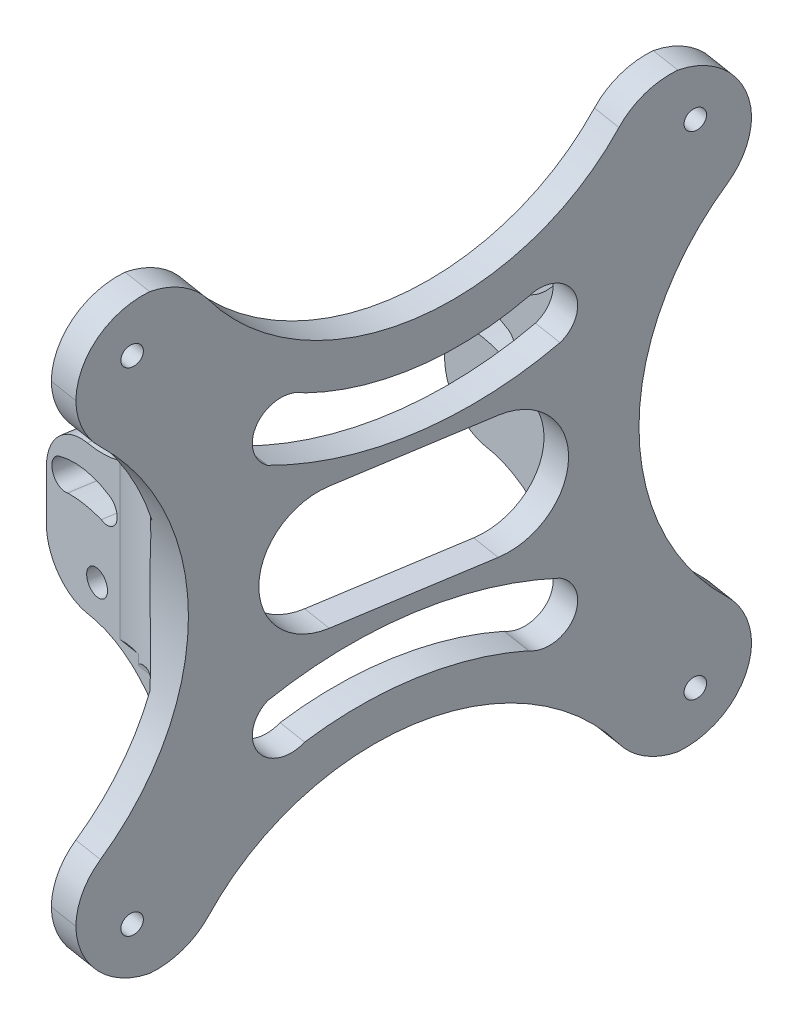
from build123d import *

# Parameters (mm, degrees)
ESQUISSE2_W                  = 31
ESQUISSE2_H                  = 30
ESQUISSE2_R                  = 2.55
BOSS_EXTRU_1_DEPTH           = 6
ESQUISSE8_W                  = 31
ESQUISSE8_H                  = 30
ESQUISSE8_R                  = 2.55
BOSS_EXTRU_3_DEPTH           = 6
ESQUISSE7_W                  = 120
ESQUISSE7_H                  = 120
ESQUISSE7_R                  = 2
BOSS_EXTRU_5_DEPTH           = 6
ESQUISSE13_W                 = 21.641206158
ESQUISSE13_H                 = 30
ESQUISSE13_W_2               = 21.658793842
BOSS_EXTRU_6_DEPTH           = 13
ENL_V_MAT_EXTRU_1_DEPTH      = 13
ENL_V_MAT_EXTRU_1_DEPTH_BACK = 10
ENL_V_MAT_EXTRU_2_DEPTH      = 10
CONG_1_R                     = 14
CONG_2_R                     = 10
ESQUISSE16_W                 = 6
ESQUISSE16_H                 = 20
BOSS_EXTRU_7_DEPTH           = 21
ENL_V_MAT_EXTRU_5_DEPTH      = 102
ESQUISSE11_R                 = 3.6
ENL_V_MAT_EXTRU_3_DEPTH      = 2
ENL_V_MAT_EXTRU_4_DEPTH      = 50
CONG_3_R                     = 2
ENL_V_MAT_EXTRU_6_DEPTH      = 10


with BuildPart() as part:
    # Esquisse2 → Boss.-Extru.1 (new body)
    with BuildSketch(Plane(origin=(0.906224424, 0, -5.721675829), x_dir=(0.9876883405951378, 0, 0.15643446504023084), z_dir=(-0.15643446504023084, 0, 0.9876883405951378))):
        with Locations((34.5, -1.155063291)):
            Rectangle(ESQUISSE2_W, ESQUISSE2_H)
        with Locations(Location((31.397260685, -9.369554149, 0), (0, 0, 180))):
            Circle(ESQUISSE2_R, mode=Mode.SUBTRACT)
        with BuildLine():
            ThreePointArc((34.496035861, 7.577601288), (36.106578838, 3.890320367), (32.419297917, 2.27977739))
            ThreePointArc((32.419297917, 2.27977739), (28.322675088, 2.630124236), (24.226052259, 2.27977739))
            ThreePointArc((24.226052259, 2.27977739), (20.538771338, 3.890320367), (22.149314314, 7.577601288))
            ThreePointArc((22.149314314, 7.577601288), (28.322675088, 8.74435419), (34.496035861, 7.577601288))
        make_face(mode=Mode.SUBTRACT)
    extrude(amount=BOSS_EXTRU_1_DEPTH)



with BuildPart() as body_2:
    # Esquisse8 → Boss.-Extru.3 (new body)
    with BuildSketch(Plane(origin=(11.027534312, 0, -69.625111466), x_dir=(-0.9876883405951388, 0, -0.15643446504022476), z_dir=(0.15643446504022476, 0, -0.9876883405951388))):
        with Locations((-34.5, -1.155063291)):
            Rectangle(ESQUISSE8_W, ESQUISSE8_H)
        with Locations(Location((-28.323632054, -8.142027265, 0), (0, 0, 180))):
            Circle(ESQUISSE8_R, mode=Mode.SUBTRACT)
        with BuildLine():
            ThreePointArc((-22.149314314, 7.577601288), (-20.538771338, 3.890320367), (-24.226052259, 2.27977739))
            ThreePointArc((-24.226052259, 2.27977739), (-28.322675088, 2.640604629), (-32.419297917, 2.27977739))
            ThreePointArc((-32.419297917, 2.27977739), (-36.106578838, 3.890320367), (-34.496035861, 7.577601288))
            ThreePointArc((-34.496035861, 7.577601288), (-28.322675088, 8.74435419), (-22.149314314, 7.577601288))
        make_face(mode=Mode.SUBTRACT)
    extrude(amount=BOSS_EXTRU_3_DEPTH)


with BuildPart() as part_1:
    add(part.part)

    add(body_2.part)  # Boss.-Extru.5 merges body 2
    # Esquisse7 → Boss.-Extru.5 (add)
    with BuildSketch(Plane(origin=(49.38441703, 0, 7.821723252), x_dir=(0.1564344650402309, 0, -0.9876883405951378), z_dir=(0.9876883405951379, 0, 0.1564344650402309))):
        with Locations((38.134203396, -0.53448162)):
            Rectangle(ESQUISSE7_W, ESQUISSE7_H)
        with Locations((-11.865796604, 49.46551838)):
            Circle(ESQUISSE7_R, mode=Mode.SUBTRACT)
        with Locations((88.134203396, 49.46551838)):
            Circle(ESQUISSE7_R, mode=Mode.SUBTRACT)
        with Locations((88.134203396, -50.53448162)):
            Circle(ESQUISSE7_R, mode=Mode.SUBTRACT)
        with Locations((-11.865796604, -50.53448162)):
            Circle(ESQUISSE7_R, mode=Mode.SUBTRACT)
    extrude(amount=BOSS_EXTRU_5_DEPTH)

    # Esquisse13 → Boss.-Extru.6 (add)
    with BuildSketch(Plane(origin=(49.38441703, 0, 7.821723252), x_dir=(-0.1564344650402309, 0, 0.9876883405951378), z_dir=(-0.9876883405951379, 0, -0.1564344650402309))):
        with Locations((-87.313600317, -1.155063291)):
            Rectangle(ESQUISSE13_W, ESQUISSE13_H)
        with Locations((11.036399683, -1.155063291)):
            Rectangle(ESQUISSE13_W_2, ESQUISSE13_H)
    extrude(amount=BOSS_EXTRU_6_DEPTH)

    # Esquisse9 → Enlèv. mat.-Extru.1 (cut, two sides: drawn at the far end of the back side and taken through both)
    with BuildSketch(Plane(origin=(49.38441703, 0, 7.821723252), x_dir=(-0.1564344650402309, 0, 0.9876883405951378), z_dir=(-0.9876883405951379, 0, -0.1564344650402309)).offset(-ENL_V_MAT_EXTRU_1_DEPTH_BACK)):
        with BuildLine():
            Line((-98.134203396, 39.46551838), (-98.134203396, -40.53448162))
            ThreePointArc((-98.134203396, -40.53448162), (-78.134203396, -0.53448162), (-98.134203396, 39.46551838))
        make_face()
        with BuildLine():
            Line((-78.134203396, -60.53448162), (1.865796604, -60.53448162))
            ThreePointArc((1.865796604, -60.53448162), (-38.134203396, -36.150009748), (-78.134203396, -60.53448162))
        make_face()
        with BuildLine():
            Line((21.865796604, 39.46551838), (21.865796604, -40.53448162))
            ThreePointArc((21.865796604, -40.53448162), (1.865796604, -0.53448162), (21.865796604, 39.46551838))
        make_face()
        with BuildLine():
            Line((1.865796604, 59.46551838), (-78.134203396, 59.46551838))
            ThreePointArc((-78.134203396, 59.46551838), (-38.134203396, 35.081046508), (1.865796604, 59.46551838))
        make_face()
    extrude(amount=ENL_V_MAT_EXTRU_1_DEPTH + ENL_V_MAT_EXTRU_1_DEPTH_BACK, mode=Mode.SUBTRACT)

    # Esquisse10 → Enlèv. mat.-Extru.2 (cut)
    with BuildSketch(Plane(origin=(49.38441703, 0, 7.821723252), x_dir=(-0.1564344650402309, 0, 0.9876883405951378), z_dir=(-0.9876883405951379, 0, -0.1564344650402309))):
        with BuildLine():
            Line((-53.134203396, 11.96551838), (-23.134203396, 11.96551838))
            ThreePointArc((-23.134203396, 11.96551838), (-10.634203396, -0.53448162), (-23.134203396, -13.03448162))
            Line((-23.134203396, -13.03448162), (-53.134203396, -13.03448162))
            ThreePointArc((-53.134203396, -13.03448162), (-65.634203396, -0.53448162), (-53.134203396, 11.96551838))
        make_face()
    extrude(amount=-ENL_V_MAT_EXTRU_2_DEPTH, mode=Mode.SUBTRACT)

    # Congé1
    # the kernel refuses this fillet: 14 mm, written as the material it takes off along each edge
    with BuildSketch(Plane(origin=(74.224993646, 59.46551838, 13.64513807), x_dir=(-0.15643446504023098, 0, 0.9876883405951377), z_dir=(-0.9876883405951377, 0, -0.15643446504023098))) as cong_1_piece_1:
        with BuildLine():
            CenterArc((7.778292272, -14), CONG_1_R, 90, 54.076548206)
            ThreePointArc((-3.558929623, -5.786145868), (-1.67012678, -2.960324325), (0, 0))
            Line((0, 0), (7.778292272, 0))
        make_face()
    extrude(amount=44.891461359, mode=Mode.SUBTRACT)
    with BuildSketch(Plane(origin=(42.400977873, 59.46551838, -72.392500921), x_dir=(-0.08195724147629681, -0.8517749604527702, 0.5174576575095567), z_dir=(0.9876883405951377, 0, 0.15643446504023104))) as cong_1_piece_2:
        with BuildLine():
            CenterArc((7.849741203, 13.960064244), CONG_1_R, 211.594748122, 54.076548206)
            Line((-4.075108243, 6.625354592), (0, 0))
            ThreePointArc((0, 0), (3.396522636, 0.128364929), (6.793045272, 0))
        make_face()
    extrude(amount=44.891461359, mode=Mode.SUBTRACT)
    with BuildSketch(Plane(origin=(30.166896719, 59.46551838, -94.579491533), x_dir=(-0.15643446504023087, 0, 0.9876883405951377), z_dir=(0.9876883405951378, 0, 0.15643446504023087))) as cong_1_piece_3:
        with BuildLine():
            CenterArc((CONG_1_R, CONG_1_R), CONG_1_R, 180, 90)
            Line((0, CONG_1_R), (0, 0))
            Line((0, 0), (CONG_1_R, 0))
        make_face()
    extrude(amount=76, mode=Mode.SUBTRACT)
    with BuildSketch(Plane(origin=(86.652299455, -40.53448162, -85.633082634), x_dir=(-0.11956994947595985, 0.64480714096111, 0.7549349496134589), z_dir=(-0.9876883405951377, 0, -0.15643446504023106))) as cong_1_piece_4:
        with BuildLine():
            CenterArc((6.525192139, -13.977047442), CONG_1_R, 93.281319456, 46.567463442)
            Line((-4.175642183, -4.949747468), (0, 0))
            ThreePointArc((0, 0), (2.861926377, -0.081973422), (5.723852754, 0))
        make_face()
    extrude(amount=38.379000772, mode=Mode.SUBTRACT)
    with BuildSketch(Plane(origin=(48.745807869, 39.46551838, -91.636881088), x_dir=(0, 1, 0), z_dir=(0.9876883405951377, 0, 0.15643446504023104))) as cong_1_piece_5:
        with BuildLine():
            CenterArc((6.475800154, 14), CONG_1_R, 223.432536558, 46.567463442)
            ThreePointArc((-3.690781129, 4.375), (-1.782734564, 2.240357048), (0, 0))
            Line((0, 0), (6.475800154, 0))
        make_face()
    extrude(amount=38.379000772, mode=Mode.SUBTRACT)
    with BuildSketch(Plane(origin=(11.394760915, 59.46551838, 23.943109339), x_dir=(0.15643446504023087, 0, -0.9876883405951377), z_dir=(0.9876883405951378, 0, 0.15643446504023087)), Plane(origin=(30.166896719, -60.53448162, -94.579491533), x_dir=(-0.15643446504023087, 0, 0.9876883405951377), z_dir=(0.9876883405951378, 0, 0.15643446504023087)), Plane(origin=(11.394760915, -60.53448162, 23.943109339), x_dir=(0, 1, 0), z_dir=(0.9876883405951378, 0, 0.15643446504023087))) as cong_1_piece_6:
        with BuildLine():
            CenterArc((CONG_1_R, -CONG_1_R), CONG_1_R, 90, 90)
            Line((0, -CONG_1_R), (0, 0))
            Line((0, 0), (CONG_1_R, 0))
        make_face()
    extrude(amount=76, mode=Mode.SUBTRACT)
    with BuildSketch(Plane(origin=(67.880163651, -40.53448162, 32.889518238), x_dir=(0.11956994947595949, 0.6448071409611126, -0.7549349496134566), z_dir=(-0.9876883405951377, 0, -0.15643446504023104))) as cong_1_piece_7:
        with BuildLine():
            CenterArc((6.525192139, 13.977047442), CONG_1_R, 220.151217102, 46.567463442)
            Line((-4.175642183, 4.949747468), (0, 0))
            ThreePointArc((0, 0), (2.861926377, 0.081973422), (5.723852754, 0))
        make_face()
    extrude(amount=38.379000772, mode=Mode.SUBTRACT)
    with BuildSketch(Plane(origin=(29.973672064, 39.46551838, 26.885719783), x_dir=(0, 1, 0), z_dir=(0.9876883405951378, 0, 0.15643446504023087))) as cong_1_piece_8:
        with BuildLine():
            CenterArc((6.475800154, -14), CONG_1_R, 90, 46.567463442)
            ThreePointArc((-3.690781129, -4.375), (-1.782734564, -2.240357048), (0, 0))
            Line((0, 0), (6.475800154, 0))
        make_face()
    extrude(amount=38.379000772, mode=Mode.SUBTRACT)
    with BuildSketch(Plane(origin=(42.400977873, -60.53448162, -72.392500921), x_dir=(-0.08195724147629661, 0.8517749604527709, 0.5174576575095556), z_dir=(0.9876883405951377, 0, 0.15643446504023098))) as cong_1_piece_9:
        with BuildLine():
            CenterArc((7.849741203, -13.960064244), CONG_1_R, 94.328703672, 54.076548206)
            Line((-4.075108243, -6.625354592), (0, 0))
            ThreePointArc((0, 0), (3.396522636, -0.128364929), (6.793045272, 0))
        make_face()
    extrude(amount=44.891461359, mode=Mode.SUBTRACT)
    with BuildSketch(Plane(origin=(74.224993646, -60.53448162, 13.64513807), x_dir=(-0.15643446504023092, 0, 0.9876883405951378), z_dir=(-0.9876883405951378, 0, -0.1564344650402309))) as cong_1_piece_10:
        with BuildLine():
            CenterArc((7.778292272, 14), CONG_1_R, 215.923451794, 54.076548206)
            ThreePointArc((-3.558929623, 5.786145868), (-1.67012678, 2.960324325), (0, 0))
            Line((0, 0), (7.778292272, 0))
        make_face()
    extrude(amount=44.891461359, mode=Mode.SUBTRACT)

    # Congé2
    cong_2_edges = [part_1.edges().sort_by_distance(p)[0] for p in [
        (30.262916178, -16.155063291, -69.615921652),
        (30.262916178, 13.844936709, -69.615921652),
        (19.2029995, 13.844936709, 0.213644029),
        (19.2029995, -16.155063291, 0.213644029),
    ]]
    fillet(cong_2_edges, radius=CONG_2_R)

    # Esquisse16 → Boss.-Extru.7 (add)
    with BuildSketch(Plane(origin=(49.38441703, 0, 7.821723252), x_dir=(-0.1564344650402309, 0, 0.9876883405951378), z_dir=(-0.9876883405951379, 0, -0.1564344650402309))):
        with Locations((-73.492997238, -26.155063291)):
            Rectangle(ESQUISSE16_W, ESQUISSE16_H)
        with Locations((-73.492997238, 23.844936709)):
            Rectangle(ESQUISSE16_W, ESQUISSE16_H)
        with Locations((-2.792997238, 23.844936709)):
            Rectangle(ESQUISSE16_W, ESQUISSE16_H)
        with Locations((-2.792997238, -26.155063291)):
            Rectangle(ESQUISSE16_W, ESQUISSE16_H)
    extrude(amount=BOSS_EXTRU_7_DEPTH)

    # Esquisse17 → Enlèv. mat.-Extru.5 (cut)
    with BuildSketch(Plane(origin=(-0.032382366, 0, 0.204454215), x_dir=(0.9876883405951378, 0, 0.15643446504023087), z_dir=(-0.15643446504023087, 0, 0.9876883405951379))):
        with BuildLine():
            Line((50, 33.844936709), (29, 33.844936709))
            Line((29, 33.844936709), (29, 13.844936709))
            ThreePointArc((29, 13.844936709), (43.642135624, 19.495694304), (50, 33.844936709))
        make_face()
        with BuildLine():
            Line((29, -16.155063291), (29, -36.155063291))
            Line((29, -36.155063291), (50, -36.155063291))
            ThreePointArc((50, -36.155063291), (43.642135624, -21.805820886), (29, -16.155063291))
        make_face()
    extrude(amount=-ENL_V_MAT_EXTRU_5_DEPTH, mode=Mode.SUBTRACT)

    # Esquisse11 → Enlèv. mat.-Extru.3 (cut)
    with BuildSketch(Plane(origin=(49.38441703, 0, 7.821723252), x_dir=(-0.1564344650402309, 0, 0.9876883405951378), z_dir=(-0.9876883405951379, 0, -0.1564344650402309))):
        with Locations((-88.134203396, 49.46551838)):
            Circle(ESQUISSE11_R)
        with Locations((11.865796604, 49.46551838)):
            Circle(ESQUISSE11_R)
        with Locations((11.865796604, -50.53448162)):
            Circle(ESQUISSE11_R)
        with Locations((-88.134203396, -50.53448162)):
            Circle(ESQUISSE11_R)
    extrude(amount=-ENL_V_MAT_EXTRU_3_DEPTH, mode=Mode.SUBTRACT)

    # Esquisse14 → Enlèv. mat.-Extru.4 (cut)
    with BuildSketch(Plane.XZ.offset(16.155063291)):
        with BuildLine():
            Line((36.512086236, 5.992529421), (35.86109163, 10.1027476))
            Line((35.86109163, 10.1027476), (48.701040057, 12.136395646))
            ThreePointArc((48.701040057, 12.136395646), (43.319279874, 7.650487854), (36.512086236, 5.992529421))
        make_face()
        with BuildLine():
            Line((48.510609704, -69.763166303), (49.15885299, -73.856013332))
            Line((49.15885299, -73.856013332), (61.998801418, -71.822365287))
            ThreePointArc((61.998801418, -71.822365287), (55.493477804, -69.228756773), (48.510609704, -69.763166303))
        make_face()
    extrude(amount=-ENL_V_MAT_EXTRU_4_DEPTH, mode=Mode.SUBTRACT)

    # Congé3
    cong_3_edges = [part_1.edges().sort_by_distance(p)[0] for p in [
        (45.161497875, -16.155063291, 7.362461643),
        (45.161497875, 13.844936709, 7.362461643),
        (57.175701713, 13.844936709, -68.390750554),
        (57.175701713, -16.155063291, -68.390750554),
    ]]
    fillet(cong_3_edges, radius=CONG_3_R)

    # Esquisse18 → Enlèv. mat.-Extru.6 (cut)
    with BuildSketch(Plane(origin=(49.38441703, 0, 7.821723252), x_dir=(-0.1564344650402309, 0, 0.9876883405951378), z_dir=(-0.9876883405951379, 0, -0.1564344650402309))):
        with BuildLine():
            ThreePointArc((-58.53089132, 30.635627759), (-38.689611602, 26.449223081), (-18.757961656, 30.181741726))
            ThreePointArc((-18.757961656, 30.181741726), (-10.465689701, 28.467978457), (-12.17945297, 20.175706502))
            ThreePointArc((-12.17945297, 20.175706502), (-38.142997238, 14.935009206), (-64.106541506, 20.175706502))
            ThreePointArc((-64.106541506, 20.175706502), (-66.548677041, 28.193492223), (-58.53089132, 30.635627759))
        make_face()
        with BuildLine():
            ThreePointArc((-58.53089132, -31.704590998), (-38.681843012, -28.198928976), (-18.757961656, -31.250704966))
            ThreePointArc((-18.757961656, -31.250704966), (-10.465689701, -29.536941697), (-12.17945297, -21.244669742))
            ThreePointArc((-12.17945297, -21.244669742), (-38.142997238, -16.518221403), (-64.106541506, -21.244669742))
            ThreePointArc((-64.106541506, -21.244669742), (-66.548677041, -29.262455463), (-58.53089132, -31.704590998))
        make_face()
    extrude(amount=-ENL_V_MAT_EXTRU_6_DEPTH, mode=Mode.SUBTRACT)


solid = part_1.part
